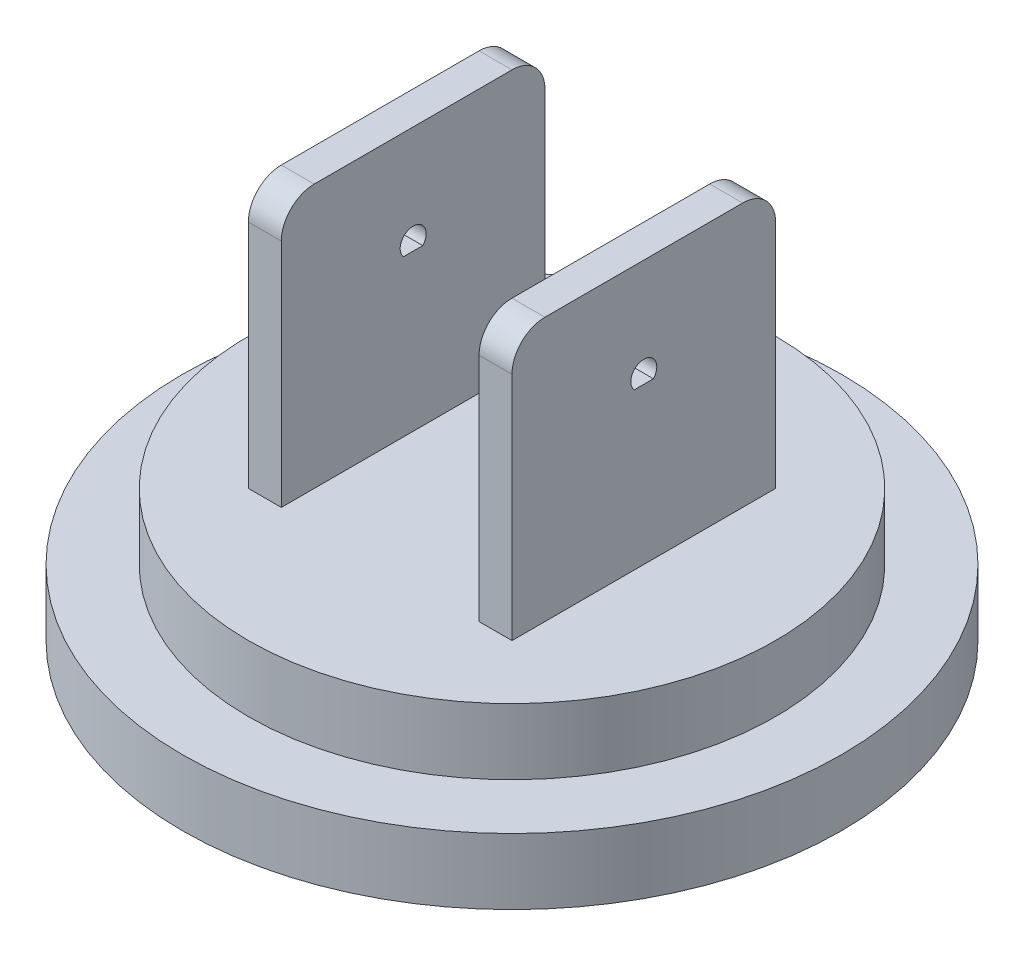
from build123d import *

# Parameters (mm, degrees)
SKETCH2_R           = 63.5
BOSS_EXTRUDE1_DEPTH = 12.7
SKETCH3_R           = 50.8
BOSS_EXTRUDE2_DEPTH = 12.7
SKETCH4_R           = 6.35
BOSS_EXTRUDE3_DEPTH = 25.4
SKETCH5_W           = 6.35
SKETCH5_H           = 50.8
BOSS_EXTRUDE4_DEPTH = 50.8
FILLET1_R           = 6.35
CUT_EXTRUDE1_DEPTH  = 134.198723718
CUT_EXTRUDE2_START  = -12.7
CUT_EXTRUDE2_DEPTH  = 12.7
CIRPATTERN1_COUNT   = 28


with BuildPart() as part:
    # Sketch2 → Boss-Extrude1 (new body)
    with BuildSketch(Plane(origin=(0, 0, 0), x_dir=(1, 0, 0), z_dir=(0, 1, 0))):
        Circle(SKETCH2_R)
    extrude(amount=BOSS_EXTRUDE1_DEPTH)

    # Sketch3 → Boss-Extrude2 (add)
    with BuildSketch(Plane(origin=(0, 12.7, 0), x_dir=(1, 0, 0), z_dir=(0, 1, 0))):
        Circle(SKETCH3_R)
    extrude(amount=BOSS_EXTRUDE2_DEPTH)

    # Sketch4 → Boss-Extrude3 (add)
    with BuildSketch(Plane.XZ):
        Circle(SKETCH4_R)
    extrude(amount=BOSS_EXTRUDE3_DEPTH)

    # Sketch5 → Boss-Extrude4 (add)
    with BuildSketch(Plane(origin=(0, 25.4, 0), x_dir=(1, 0, 0), z_dir=(0, 1, 0))):
        with Locations((22.225, 0)):
            Rectangle(SKETCH5_W, SKETCH5_H)
        with Locations((-22.225, 0)):
            Rectangle(SKETCH5_W, SKETCH5_H)
    extrude(amount=BOSS_EXTRUDE4_DEPTH)

    # Fillet1
    fillet1_edges = [part.edges().sort_by_distance(p)[0] for p in [
        (22.225, 76.2, 25.4),
        (-22.225, 76.2, 25.4),
        (22.225, 76.2, -25.4),
        (-22.225, 76.2, -25.4),
    ]]
    fillet(fillet1_edges, radius=FILLET1_R)

    # Sketch6 → Cut-Extrude1 (cut, through all)
    with BuildSketch(Plane.ZY.offset(25.4)):
        with BuildLine():
            Line((-1.855488288, 55.47170717), (1.855488288, 55.47170717))
            ThreePointArc((1.855488288, 55.47170717), (0, 59.6519), (-1.855488288, 55.47170717))
        make_face()
    extrude(amount=-CUT_EXTRUDE1_DEPTH, mode=Mode.SUBTRACT)

    # Sketch7 → Cut-Extrude2 (cut)
    with BuildSketch(Plane.XZ.offset(25.4).offset(CUT_EXTRUDE2_START)):
        with BuildLine():
            Line((0, 5.08), (0.710231041, 6.310156248))
            ThreePointArc((0.710231041, 6.310156248), (0, 6.35), (-0.710231041, 6.310156248))
            Line((-0.710231041, 6.310156248), (0, 5.08))
        make_face()
    cut_extrude2 = extrude(amount=CUT_EXTRUDE2_DEPTH, mode=Mode.SUBTRACT)

    # CirPattern1: Cut-Extrude2 ×28 about axis
    cirpattern1_axis = Axis((0, -25.4, 0), (0, 1, 0))
    for i in range(1, CIRPATTERN1_COUNT):
        add(cut_extrude2.rotate(cirpattern1_axis, i * 360 / CIRPATTERN1_COUNT), mode=Mode.SUBTRACT)


solid = part.part
